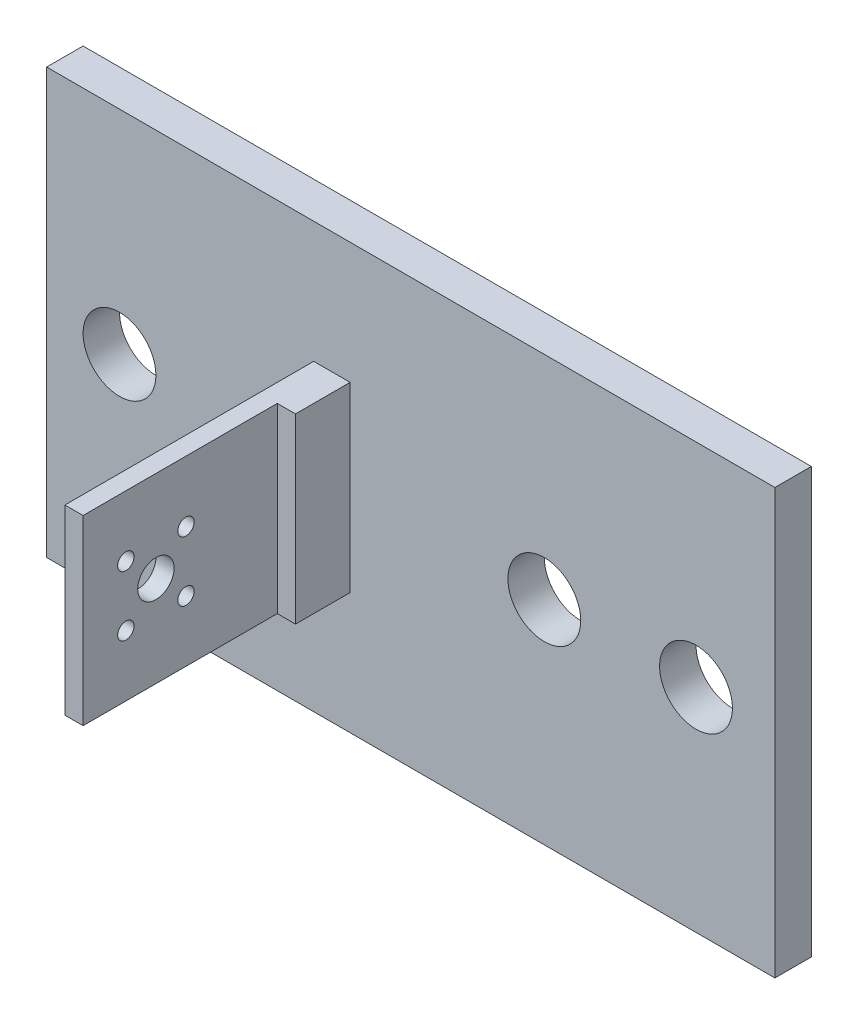
from build123d import *

# Parameters (mm, degrees)
S_BOX1_W      = 120
S_BOX1_H      = 70
BOSS_1_DEPTH  = 6
S_BOX2_W      = 3
S_BOX2_H      = 30
BOSS_2_DEPTH  = 41.5
S_BOX3_W      = 3.5
S_BOX3_H      = 30
BOSS_3_DEPTH  = 9.5
S_HOLE4_R     = 3
HOLE_4_DEPTH  = 3.2
S_HOLE5_R     = 1.35
HOLE_5_DEPTH  = 3.2
S_HOLE6_R     = 1.35
HOLE_6_DEPTH  = 3.2
S_HOLE7_R     = 1.35
HOLE_7_DEPTH  = 3.2
S_HOLE8_R     = 1.35
HOLE_8_DEPTH  = 3.2
S_HOLE9_R     = 6
HOLE_9_DEPTH  = 6.2
S_HOLE10_R    = 6
HOLE_10_DEPTH = 6.2
S_HOLE11_R    = 6
HOLE_11_DEPTH = 6.2
S_HOLE12_R    = 6
HOLE_12_DEPTH = 6.2


with BuildPart() as part:
    # S_box1 → Boss_1 (new body)
    with BuildSketch(Plane.XY.offset(-35)):
        with Locations((-2, 0)):
            Rectangle(S_BOX1_W, S_BOX1_H)
    extrude(amount=BOSS_1_DEPTH)

    # S_box2 → Boss_2 (add)
    with BuildSketch(Plane.XY.offset(-29.5)):
        with Locations((-16.5, 0)):
            Rectangle(S_BOX2_W, S_BOX2_H)
    extrude(amount=BOSS_2_DEPTH)

    # S_box3 → Boss_3 (add)
    with BuildSketch(Plane.XY.offset(-29.5)):
        with Locations((-13.75, 0)):
            Rectangle(S_BOX3_W, S_BOX3_H)
    extrude(amount=BOSS_3_DEPTH)

    # S_hole4 → Hole_4 (cut)
    with BuildSketch(Plane(origin=(-18.1, 0, 0), x_dir=(0, 0, -1), z_dir=(1, 0, 0))):
        Circle(S_HOLE4_R)
    extrude(amount=HOLE_4_DEPTH, mode=Mode.SUBTRACT)

    # S_hole5 → Hole_5 (cut)
    with BuildSketch(Plane(origin=(-18.1, 0, 0), x_dir=(0, 0, -1), z_dir=(1, 0, 0))):
        with Locations((-4.949747468, 4.949747468)):
            Circle(S_HOLE5_R)
    extrude(amount=HOLE_5_DEPTH, mode=Mode.SUBTRACT)

    # S_hole6 → Hole_6 (cut)
    with BuildSketch(Plane(origin=(-18.1, 0, 0), x_dir=(0, 0, -1), z_dir=(1, 0, 0))):
        with Locations((-4.949747468, -4.949747468)):
            Circle(S_HOLE6_R)
    extrude(amount=HOLE_6_DEPTH, mode=Mode.SUBTRACT)

    # S_hole7 → Hole_7 (cut)
    with BuildSketch(Plane(origin=(-18.1, 0, 0), x_dir=(0, 0, -1), z_dir=(1, 0, 0))):
        with Locations((4.949747468, -4.949747468)):
            Circle(S_HOLE7_R)
    extrude(amount=HOLE_7_DEPTH, mode=Mode.SUBTRACT)

    # S_hole8 → Hole_8 (cut)
    with BuildSketch(Plane(origin=(-18.1, 0, 0), x_dir=(0, 0, -1), z_dir=(1, 0, 0))):
        with Locations((4.949747468, 4.949747468)):
            Circle(S_HOLE8_R)
    extrude(amount=HOLE_8_DEPTH, mode=Mode.SUBTRACT)

    # S_hole9 → Hole_9 (cut)
    with BuildSketch(Plane.XY.offset(-35.1)):
        with Locations((-50, 0)):
            Circle(S_HOLE9_R)
    extrude(amount=HOLE_9_DEPTH, mode=Mode.SUBTRACT)

    # S_hole10 → Hole_10 (cut)
    with BuildSketch(Plane.XY.offset(-35.1)):
        with Locations((-20, 0)):
            Circle(S_HOLE10_R)
    extrude(amount=HOLE_10_DEPTH, mode=Mode.SUBTRACT)

    # S_hole11 → Hole_11 (cut)
    with BuildSketch(Plane.XY.offset(-35.1)):
        with Locations((20, 0)):
            Circle(S_HOLE11_R)
    extrude(amount=HOLE_11_DEPTH, mode=Mode.SUBTRACT)

    # S_hole12 → Hole_12 (cut)
    with BuildSketch(Plane.XY.offset(-35.1)):
        with Locations((45, 0)):
            Circle(S_HOLE12_R)
    extrude(amount=HOLE_12_DEPTH, mode=Mode.SUBTRACT)


solid = part.part
